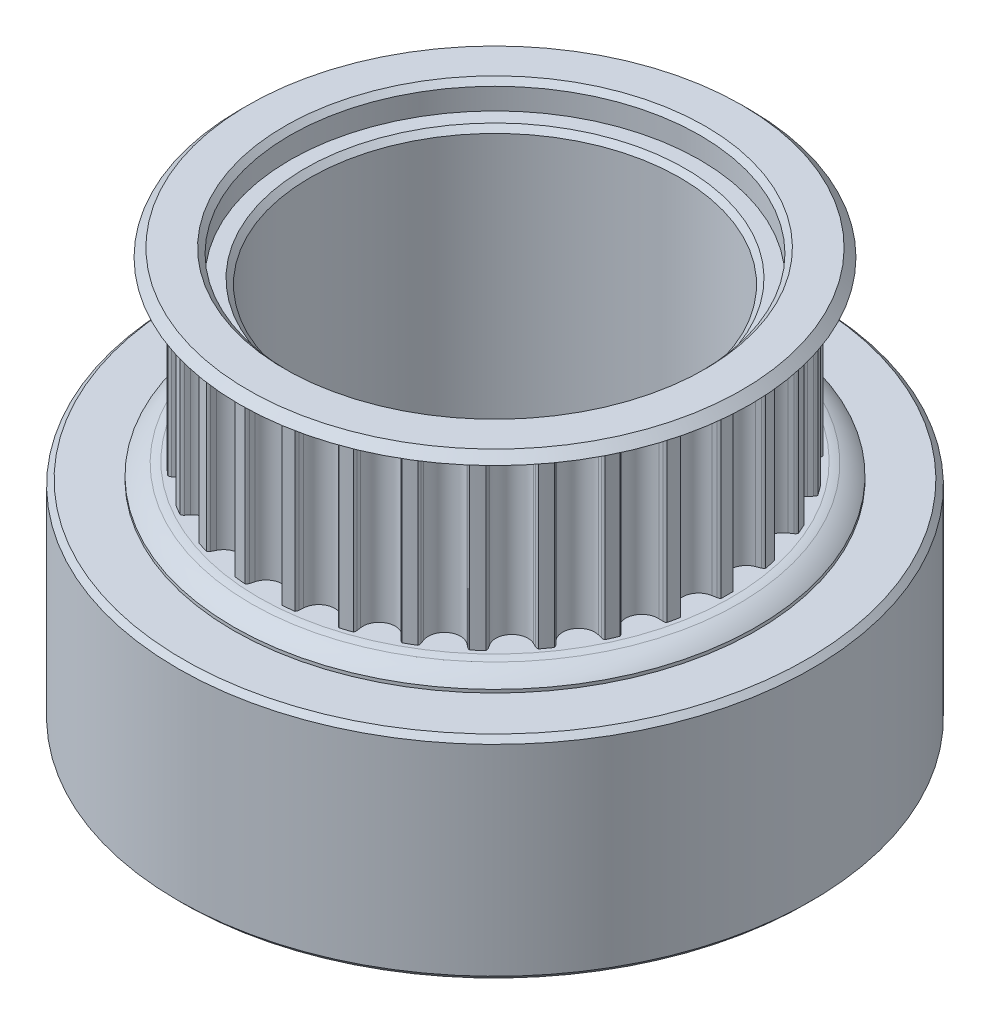
from build123d import *

# Parameters (mm, degrees)
SKETCH1_R               = 13.942945337
TOOTHOD_DEPTH           = 5.08
TOOTHPROFILE_DEPTH      = 21.362167108
TOOTHPATTERN_COUNT      = 30
LARGE_START             = 5.6325
LARGE_TOOTH_COUNT_DEPTH = 1.3675
SKETCH12_R              = 19.05
BOSS_EXTRUDE1_DEPTH     = 12.7
SKETCH13_R              = 11.1125
CUT_EXTRUDE1_DEPTH      = 37.593855085
SKETCH14_R              = 12.7
CUT_EXTRUDE2_DEPTH      = 1.6002
SKETCH15_R              = 12.319
CUT_EXTRUDE3_DEPTH      = 1.6002
CHAMFER1_SIZE           = 0.3175
CHAMFER2_SIZE           = 0.3175
CHAMFER3_SIZE           = 0.889


with BuildPart() as part:
    # Sketch1 → ToothOD (new, symmetric)
    with BuildSketch(Plane(origin=(0, 0, 0), x_dir=(1, 0, 0), z_dir=(0, 1, 0))):
        with Locations(Location((0, 0, 0), (0, 0, 270))):
            Circle(SKETCH1_R)
    extrude(amount=TOOTHOD_DEPTH, both=True)

    # Sketch2 → ToothProfile (cut, symmetric)
    with BuildSketch(Plane(origin=(0, 0, 0), x_dir=(1, 0, 0), z_dir=(0, 1, 0))):
        with BuildLine():
            ThreePointArc((-0.937033068, 13.493007333), (-0.590385173, 12.974832723), (0, 12.774545337))
            ThreePointArc((0, 12.774545337), (0.590385173, 12.974832723), (0.937033068, 13.493007333))
            ThreePointArc((0.937033068, 13.493007333), (0.971699064, 13.619118795), (1.007805813, 13.744825337))
            ThreePointArc((1.007805813, 13.744825337), (1.04827578, 13.830028138), (1.113221937, 13.898433782))
            ThreePointArc((1.113221937, 13.898433782), (0, 13.942945337), (-1.113221937, 13.898433782))
            ThreePointArc((-1.113221937, 13.898433782), (-1.04827578, 13.830028138), (-1.007805813, 13.744825337))
            ThreePointArc((-1.007805813, 13.744825337), (-0.971699064, 13.619118795), (-0.937033068, 13.493007333))
        make_face()
    toothprofile = extrude(amount=TOOTHPROFILE_DEPTH, both=True, mode=Mode.SUBTRACT)

    # ToothPattern: ToothProfile ×30 about axis
    toothpattern_axis = Axis((0, 0, 0), (0, 1, 0))
    for i in range(1, TOOTHPATTERN_COUNT):
        add(toothprofile.rotate(toothpattern_axis, i * 360 / TOOTHPATTERN_COUNT), mode=Mode.SUBTRACT)

    # Sketch4 → Flange (revolve)
    with BuildSketch(Plane.XY, mode=Mode.PRIVATE) as flange_sk:
        with BuildLine():
            Line((0, -5.08), (14.196945337, -5.08))
            ThreePointArc((14.196945337, -5.08), (14.426591958, -5.115951298), (14.652017665, -5.172637424))
            ThreePointArc((14.652017665, -5.172637424), (15.219746242, -5.454197125), (15.720945337, -5.842))
            Line((15.720945337, -5.842), (15.720945337, -6.0325))
            Line((15.720945337, -6.0325), (0, -6.0325))
            Line((0, -6.0325), (0, -5.08))
        make_face()
        with BuildLine():
            Line((15.720945337, 6.0325), (15.720945337, 5.842))
            ThreePointArc((15.720945337, 5.842), (15.219746242, 5.454197125), (14.652017665, 5.172637424))
            ThreePointArc((14.652017665, 5.172637424), (14.426591958, 5.115951298), (14.196945337, 5.08))
            Line((14.196945337, 5.08), (0, 5.08))
            Line((0, 5.08), (0, 6.0325))
            Line((0, 6.0325), (15.720945337, 6.0325))
        make_face()
    revolve(flange_sk.sketch.rotate(Axis((0, 8.73125, 0), (0, -1, 0)), 90), axis=Axis((0, 8.73125, 0), (0, -1, 0)))

    # Large Tooth Count: read off the stored shape, not the designer's step
    # Large Tooth Count outline → Large Tooth Count (cut)
    # profile 1 of 2: a face of its own
    with BuildSketch(Plane(origin=(0, 0, 0), x_dir=(1, 0, 0), z_dir=(0, 1, 0)).offset(LARGE_START)):
        with BuildLine():
            add(Edge.make_bspline(
                [(3.894236719, 10.338692969), (3.901916731, 10.292057015), (3.917793763, 10.195645638), (3.925855583, 10.04382702), (3.927405181, 9.88165912), (3.91663913, 9.708484938), (3.897025732, 9.524940839), (3.866969089, 9.330490815), (3.827897551, 9.125211805), (3.79505084, 8.985432902), (3.778150781, 8.913514844)],
                knots=[0, 0, 0, 0, 0.098412255, 0.20344949, 0.316329363, 0.436224099, 0.564713832, 0.700846686, 0.84608174, 1, 1, 1, 1], degree=3))
            add(Edge.make_bspline(
                [(2.820888281, 11.507589062), (2.869414473, 11.494553642), (2.964310988, 11.469061924), (3.099186919, 11.41527872), (3.224642668, 11.352445393), (3.339573531, 11.277689048), (3.444280904, 11.193341702), (3.540153241, 11.100296317), (3.623844048, 10.995849089), (3.698334598, 10.882866857), (3.762985924, 10.760583873), (3.817301104, 10.628654462), (3.862284944, 10.487369798), (3.883445455, 10.388906483), (3.894236719, 10.338692969)],
                knots=[0, 0, 0, 0, 0.089277524, 0.174588721, 0.257670783, 0.338413673, 0.417848417, 0.496444716, 0.575467554, 0.655324359, 0.736770208, 0.821005813, 0.908718012, 1, 1, 1, 1], degree=3))
            add(Edge.make_bspline(
                [(1.336774219, 10.975379688), (1.359545364, 11.005507681), (1.40431059, 11.064735553), (1.478186261, 11.146141205), (1.554984069, 11.22026595), (1.634663261, 11.28777983), (1.717999776, 11.347711489), (1.804600367, 11.400810688), (1.895150095, 11.445205889), (1.988481682, 11.483047165), (2.084591569, 11.513417291), (2.18323999, 11.535505994), (2.284037248, 11.551121753), (2.387093352, 11.558084685), (2.492720013, 11.55684089), (2.600440249, 11.54896046), (2.71061723, 11.533037624), (2.783785753, 11.516151654), (2.820888281, 11.507589062)],
                knots=[0, 0, 0, 0, 0.067302816, 0.13230893, 0.195736244, 0.257501144, 0.318328765, 0.378579543, 0.438386976, 0.49790884, 0.557995798, 0.61785971, 0.677977126, 0.739682721, 0.801775047, 0.866165223, 0.932134633, 1, 1, 1, 1], degree=3))
            add(Edge.make_bspline(
                [(0.793849219, 9.592171094), (0.812119434, 9.665225645), (0.847760684, 9.807739326), (0.907837688, 10.013678281), (0.970226185, 10.207405296), (1.035985365, 10.388347446), (1.104857482, 10.556220165), (1.178846885, 10.709215908), (1.25326624, 10.849310477), (1.309629122, 10.93439964), (1.336774219, 10.975379688)],
                knots=[0, 0, 0, 0, 0.151252288, 0.295060605, 0.430820637, 0.560008289, 0.68170513, 0.795094504, 0.901314847, 1, 1, 1, 1], degree=3))
            add(Edge.make_bspline(
                [(0.674191406, 8.356302344), (0.670127884, 8.401811485), (0.661853082, 8.494484562), (0.658554359, 8.636721724), (0.663427053, 8.783911552), (0.674765904, 8.936236694), (0.695212076, 9.093362462), (0.720728065, 9.255785235), (0.753987411, 9.422788104), (0.780417574, 9.535096609), (0.793849219, 9.592171094)],
                knots=[0, 0, 0, 0, 0.109828413, 0.223650385, 0.341784368, 0.463797518, 0.590729468, 0.722618112, 0.859036246, 1, 1, 1, 1], degree=3))
            add(Edge.make_bspline(
                [(1.762720312, 7.100788281), (1.726485301, 7.110219213), (1.654854194, 7.128862731), (1.551943937, 7.168683435), (1.452777386, 7.212229662), (1.359157063, 7.265071877), (1.270121863, 7.323686891), (1.185224217, 7.389237766), (1.106228149, 7.462850417), (1.030952794, 7.541915561), (0.962512555, 7.627529404), (0.900791846, 7.71819116), (0.845202939, 7.812869749), (0.796603975, 7.912499165), (0.756128877, 8.017031257), (0.720740624, 8.125645527), (0.692960862, 8.239083587), (0.680499048, 8.31690994), (0.674191406, 8.356302344)],
                knots=[0, 0, 0, 0, 0.06345532, 0.125441517, 0.186905328, 0.247025311, 0.307517243, 0.367605419, 0.428703197, 0.490489634, 0.552621639, 0.614377127, 0.676375659, 0.738696092, 0.802167478, 0.8663517, 0.93235289, 1, 1, 1, 1], degree=3))
            add(Edge.make_bspline(
                [(3.141464062, 7.504410156), (3.094364004, 7.45904324), (3.001525209, 7.369620639), (2.844701739, 7.259870554), (2.678862343, 7.1720256), (2.504423623, 7.107731829), (2.323358035, 7.066649143), (2.137984937, 7.053700322), (1.949409538, 7.060734477), (1.82556407, 7.087305277), (1.762720312, 7.100788281)],
                knots=[0, 0, 0, 0, 0.130088367, 0.256416819, 0.379732325, 0.502967998, 0.625660579, 0.74815677, 0.872205458, 1, 1, 1, 1], degree=3))
            add(Edge.make_bspline(
                [(3.778150781, 8.913514844), (3.758210931, 8.835069277), (3.719734134, 8.683697325), (3.654537704, 8.467784966), (3.586432321, 8.270667435), (3.516707047, 8.090226333), (3.437981516, 7.925407307), (3.350580376, 7.773033966), (3.252607818, 7.631896464), (3.178276301, 7.546635257), (3.141464062, 7.504410156)],
                knots=[0, 0, 0, 0, 0.155353781, 0.299777364, 0.432766126, 0.555630248, 0.670888315, 0.78300349, 0.892533779, 1, 1, 1, 1], degree=3))
        make_face()
        with BuildLine():
            add(Edge.make_bspline(
                [(1.895772656, 7.674074219), (1.917431552, 7.669511455), (1.95987923, 7.66056923), (2.023623586, 7.654108351), (2.085281196, 7.655205787), (2.144713003, 7.661949258), (2.201703762, 7.676544585), (2.256580265, 7.698164562), (2.309218275, 7.726865048), (2.37780689, 7.775030825), (2.459600173, 7.851841236), (2.548068709, 7.965693825), (2.63173208, 8.101218004), (2.693557362, 8.230444536), (2.740743866, 8.346145341), (2.778592813, 8.441570755), (2.813706711, 8.545425584), (2.850844837, 8.655509634), (2.885893356, 8.774089935), (2.923102942, 8.898995595), (2.957340831, 9.032174447), (2.980453294, 9.123060876), (2.992338281, 9.169796875)],
                knots=[0, 0, 0, 0, 0.0322864, 0.063275743, 0.093249982, 0.122127816, 0.150361453, 0.178834645, 0.207988828, 0.237630766, 0.300949605, 0.370821424, 0.447482609, 0.532959593, 0.579503437, 0.62983717, 0.682724401, 0.739453358, 0.799364059, 0.863146039, 0.929626385, 1, 1, 1, 1], degree=3))
            add(Edge.make_bspline(
                [(1.6144875, 9.482335938), (1.603726759, 9.436806536), (1.582651627, 9.347636275), (1.552496469, 9.21662273), (1.528467436, 9.090977592), (1.504918347, 8.971625086), (1.488028832, 8.857932651), (1.47216347, 8.75030125), (1.460659497, 8.648445202), (1.449800154, 8.523534382), (1.446772112, 8.379655916), (1.456939252, 8.220807756), (1.484788768, 8.080533086), (1.522740626, 7.976807846), (1.561161367, 7.90415918), (1.595831471, 7.857045773), (1.633087022, 7.813257774), (1.676719701, 7.775542692), (1.724977584, 7.74290427), (1.777203971, 7.713644995), (1.834552387, 7.690434036), (1.875101134, 7.679598244), (1.895772656, 7.674074219)],
                knots=[0, 0, 0, 0, 0.069238648, 0.135605306, 0.198930111, 0.258544042, 0.315613518, 0.369002577, 0.419546225, 0.467286253, 0.554525106, 0.632266141, 0.702416642, 0.765420408, 0.794987156, 0.823715053, 0.851811191, 0.879907329, 0.9087431, 0.93792338, 0.96835369, 1, 1, 1, 1], degree=3))
            add(Edge.make_bspline(
                [(2.690514844, 10.933410156), (2.659689633, 10.939648364), (2.599645863, 10.951799635), (2.509369027, 10.954924508), (2.423423844, 10.94197368), (2.341498764, 10.915795422), (2.263932177, 10.874944749), (2.19098721, 10.819478314), (2.122764926, 10.749778166), (2.059450384, 10.66540212), (1.998899965, 10.567339232), (1.940015427, 10.454938773), (1.882663247, 10.328243869), (1.82511002, 10.187589391), (1.770014548, 10.031950273), (1.717162785, 9.861584316), (1.664015436, 9.67710305), (1.631391416, 9.548810075), (1.6144875, 9.482335938)],
                knots=[0, 0, 0, 0, 0.047014119, 0.0915778, 0.134351293, 0.176470361, 0.219705237, 0.264872576, 0.313064184, 0.365182147, 0.422408158, 0.485372449, 0.554936154, 0.630457004, 0.712736234, 0.80191367, 0.897362907, 1, 1, 1, 1], degree=3))
            add(Edge.make_bspline(
                [(2.992338281, 9.169796875), (3.00331221, 9.214087916), (3.024761386, 9.300657306), (3.051879167, 9.428634175), (3.077066724, 9.550578826), (3.099028303, 9.666859416), (3.115358856, 9.777512558), (3.130187763, 9.882196019), (3.140857019, 9.981368546), (3.150431123, 10.103046348), (3.152968095, 10.243327603), (3.142068531, 10.398156052), (3.112807563, 10.534385708), (3.074945104, 10.635418058), (3.034198784, 10.705076117), (3.000726783, 10.752812258), (2.961095102, 10.794888272), (2.916408449, 10.831850632), (2.867480663, 10.865296163), (2.812500109, 10.892504077), (2.753414148, 10.916093304), (2.711778417, 10.927556067), (2.690514844, 10.933410156)],
                knots=[0, 0, 0, 0, 0.068708903, 0.134295506, 0.196973272, 0.256228657, 0.312458617, 0.365390344, 0.415434452, 0.462635647, 0.54915566, 0.626507233, 0.69578835, 0.758382716, 0.787905111, 0.817136839, 0.845995028, 0.874633069, 0.904345408, 0.935016025, 0.966812364, 1, 1, 1, 1], degree=3))
        make_face(mode=Mode.SUBTRACT)
    # profile 2 of 2: a face of its own
    with BuildSketch(Plane(origin=(0, 0, 0), x_dir=(1, 0, 0), z_dir=(0, 1, 0)).offset(LARGE_START)):
        with BuildLine():
            add(Edge.make_bspline(
                [(-2.94594696, 9.277684109), (-2.949917568, 9.29962064), (-2.957676953, 9.342489144), (-2.952309575, 9.407415503), (-2.930459491, 9.468217654), (-2.895156071, 9.52532543), (-2.843820429, 9.577128015), (-2.77633668, 9.620205468), (-2.69460196, 9.65743178), (-2.633718848, 9.674169015), (-2.601261023, 9.683091921)],
                knots=[0, 0, 0, 0, 0.111385208, 0.217669656, 0.321925023, 0.432447933, 0.551639791, 0.684027163, 0.831549495, 1, 1, 1, 1], degree=3))
            add(Edge.make_bspline(
                [(-2.537860241, 9.067836452), (-2.563345482, 9.062582269), (-2.611900796, 9.052571826), (-2.683195784, 9.05054596), (-2.748054181, 9.060179778), (-2.806177123, 9.08120024), (-2.855660967, 9.115528836), (-2.896469735, 9.159890359), (-2.927478145, 9.215059165), (-2.939622395, 9.256238469), (-2.94594696, 9.277684109)],
                knots=[0, 0, 0, 0, 0.149888658, 0.285572774, 0.408932043, 0.52629045, 0.638683176, 0.752910103, 0.87131883, 1, 1, 1, 1], degree=3))
            add(Edge.make_bspline(
                [(-2.20299696, 9.174099734), (-2.214034855, 9.171208214), (-2.238920184, 9.16468918), (-2.279758872, 9.151666389), (-2.329005407, 9.137210905), (-2.381806266, 9.117898242), (-2.433232347, 9.100124068), (-2.477418199, 9.085951626), (-2.510858631, 9.074847802), (-2.530101116, 9.069851219), (-2.537860241, 9.067836452)],
                knots=[0, 0, 0, 0, 0.097390688, 0.219570781, 0.365850052, 0.535413751, 0.699343424, 0.830322618, 0.931581186, 1, 1, 1, 1], degree=3))
            add(Edge.make_bspline(
                [(-1.315386023, 8.61956614), (-1.322709249, 8.647075291), (-1.336962987, 8.700618386), (-1.364840565, 8.777179887), (-1.397782915, 8.847667999), (-1.435347332, 8.912294619), (-1.477381013, 8.971014306), (-1.524950804, 9.022948856), (-1.577295531, 9.068691377), (-1.633172867, 9.109131522), (-1.693697714, 9.142031721), (-1.75706734, 9.16956536), (-1.824593544, 9.187521739), (-1.894389567, 9.200753768), (-1.96753284, 9.204698034), (-2.0434192, 9.201926041), (-2.122628351, 9.192092813), (-2.175698243, 9.180211423), (-2.20299696, 9.174099734)],
                knots=[0, 0, 0, 0, 0.071899262, 0.13994285, 0.205548865, 0.268236407, 0.328560647, 0.387648672, 0.445732678, 0.503957705, 0.561518399, 0.619485437, 0.67805912, 0.737657048, 0.798689693, 0.862654426, 0.929350565, 1, 1, 1, 1], degree=3))
            add(Edge.make_bspline(
                [(-1.86724071, 7.681055984), (-1.837183626, 7.689463317), (-1.777450291, 7.706171459), (-1.692639817, 7.745990775), (-1.611999849, 7.794891645), (-1.536938547, 7.854887079), (-1.469078658, 7.924668545), (-1.409270706, 8.003195208), (-1.362344355, 8.092435819), (-1.323643469, 8.188158463), (-1.297548488, 8.290794376), (-1.286782816, 8.397884164), (-1.292192894, 8.508640463), (-1.307514329, 8.581918224), (-1.315386023, 8.61956614)],
                knots=[0, 0, 0, 0, 0.077153613, 0.153329661, 0.231058322, 0.310240628, 0.390495891, 0.471559113, 0.553664103, 0.639329823, 0.726730839, 0.814871257, 0.904886403, 1, 1, 1, 1], degree=3))
            add(Edge.make_bspline(
                [(-2.880760241, 8.279345046), (-2.840146087, 8.221924331), (-2.763275821, 8.113244348), (-2.643134651, 7.968332618), (-2.526935312, 7.849477456), (-2.42922311, 7.769989931), (-2.350209293, 7.720824629), (-2.289399441, 7.69360621), (-2.226163443, 7.672124327), (-2.159648697, 7.66052623), (-2.090325201, 7.653466747), (-2.018261324, 7.656288181), (-1.943083379, 7.663601664), (-1.893040053, 7.675118561), (-1.86724071, 7.681055984)],
                knots=[0, 0, 0, 0, 0.165973302, 0.314137076, 0.443807833, 0.55781674, 0.610474885, 0.662982821, 0.714752237, 0.767667561, 0.821991507, 0.878920135, 0.937578471, 1, 1, 1, 1], degree=3))
            add(Edge.make_bspline(
                [(-3.178118835, 8.375785671), (-3.150131631, 8.380276222), (-3.093139962, 8.389420545), (-3.02162568, 8.372587399), (-2.968257695, 8.352256092), (-2.932572939, 8.33268363), (-2.90331007, 8.308201079), (-2.888190598, 8.28885335), (-2.880760241, 8.279345046)],
                knots=[0, 0, 0, 0, 0.256050239, 0.521407237, 0.655347367, 0.776762548, 0.890291534, 1, 1, 1, 1], degree=3))
            add(Edge.make_bspline(
                [(-3.470119616, 7.906977077), (-3.475325537, 7.933941849), (-3.485453596, 7.986401498), (-3.483017547, 8.065108638), (-3.463328964, 8.138895905), (-3.429411449, 8.206764734), (-3.382066956, 8.266431933), (-3.323671915, 8.315932553), (-3.254630664, 8.352875077), (-3.204042084, 8.36802325), (-3.178118835, 8.375785671)],
                knots=[0, 0, 0, 0, 0.132842496, 0.258443535, 0.377780704, 0.500379028, 0.623637807, 0.744457267, 0.869051518, 1, 1, 1, 1], degree=3))
            add(Edge.make_bspline(
                [(-1.732402429, 7.108663015), (-1.78995484, 7.096263324), (-1.902518405, 7.072011456), (-2.071623422, 7.054688982), (-2.235392196, 7.056615676), (-2.392853151, 7.075139492), (-2.541602784, 7.109784448), (-2.68132906, 7.153982565), (-2.810841487, 7.209177956), (-2.928510914, 7.276155947), (-3.03673664, 7.348561885), (-3.132731485, 7.428427523), (-3.221744177, 7.508646213), (-3.296149122, 7.594969803), (-3.359179661, 7.679673972), (-3.409306166, 7.759988139), (-3.447823434, 7.834246326), (-3.463016839, 7.883807625), (-3.470119616, 7.906977077)],
                knots=[0, 0, 0, 0, 0.08457062, 0.165406981, 0.243699319, 0.319526444, 0.39279548, 0.462876615, 0.529947367, 0.594685472, 0.657216229, 0.716814358, 0.774026302, 0.829201079, 0.880281717, 0.925628669, 0.965232085, 1, 1, 1, 1], degree=3))
            add(Edge.make_bspline(
                [(-0.522429773, 8.845487234), (-0.512804258, 8.801599057), (-0.493632908, 8.714186003), (-0.482590316, 8.579872073), (-0.485507232, 8.444693761), (-0.501330756, 8.309094168), (-0.531599076, 8.174885678), (-0.577118563, 8.043894493), (-0.634636142, 7.915435297), (-0.708793658, 7.792723738), (-0.793962139, 7.674284997), (-0.89354113, 7.564580433), (-1.005472213, 7.463185896), (-1.128143398, 7.369115663), (-1.263551577, 7.28663598), (-1.409018525, 7.213188851), (-1.566404357, 7.153656714), (-1.676464381, 7.123824996), (-1.732402429, 7.108663015)],
                knots=[0, 0, 0, 0, 0.057089976, 0.113707371, 0.170878863, 0.228819664, 0.287041721, 0.345460342, 0.404921953, 0.465687476, 0.527472611, 0.590190014, 0.653696417, 0.719337597, 0.78646923, 0.855031772, 0.926319844, 1, 1, 1, 1], degree=3))
            add(Edge.make_bspline(
                [(-1.47433446, 9.708095046), (-1.432456629, 9.696848934), (-1.350451172, 9.674826721), (-1.233436671, 9.631309675), (-1.123743746, 9.582665972), (-1.022634717, 9.525742287), (-0.928658547, 9.464090834), (-0.844220178, 9.394403389), (-0.767571743, 9.319414415), (-0.700437762, 9.236866525), (-0.642561638, 9.14789902), (-0.591621008, 9.053759217), (-0.55138575, 8.952305824), (-0.532169275, 8.881416256), (-0.522429773, 8.845487234)],
                knots=[0, 0, 0, 0, 0.095898995, 0.18779007, 0.275931845, 0.361143286, 0.444259518, 0.524291367, 0.603000555, 0.681178853, 0.759182165, 0.837559969, 0.917670375, 1, 1, 1, 1], degree=3))
            add(Edge.make_bspline(
                [(-1.211801648, 10.758226296), (-1.201267759, 10.709607183), (-1.180867972, 10.615452066), (-1.172552485, 10.47486065), (-1.180191247, 10.340898736), (-1.210288776, 10.212925101), (-1.256770723, 10.088195907), (-1.314823754, 9.961961751), (-1.387413216, 9.833798483), (-1.444790204, 9.750821247), (-1.47433446, 9.708095046)],
                knots=[0, 0, 0, 0, 0.132781047, 0.257141981, 0.375152233, 0.4901777, 0.606947917, 0.73046627, 0.861213113, 1, 1, 1, 1], degree=3))
            add(Edge.make_bspline(
                [(-2.748600866, 11.525286452), (-2.702025467, 11.535972239), (-2.610978804, 11.556861061), (-2.474273552, 11.573048977), (-2.341739477, 11.58006072), (-2.212945958, 11.574472598), (-2.08860274, 11.558631596), (-1.969505268, 11.531997259), (-1.856149597, 11.494219491), (-1.7489939, 11.446120877), (-1.649202881, 11.388120519), (-1.557302506, 11.321812308), (-1.474505332, 11.246644501), (-1.402395917, 11.161960075), (-1.338556767, 11.071121681), (-1.285688991, 10.972671336), (-1.242481103, 10.868218843), (-1.222080982, 10.795079953), (-1.211801648, 10.758226296)],
                knots=[0, 0, 0, 0, 0.074476323, 0.145588031, 0.214370502, 0.28127726, 0.34634367, 0.409637131, 0.471293809, 0.532381628, 0.592496844, 0.650996873, 0.708830001, 0.766433503, 0.824126724, 0.881664718, 0.940372517, 1, 1, 1, 1], degree=3))
            add(Edge.make_bspline(
                [(-3.891600866, 10.168866921), (-3.897202831, 10.195846888), (-3.90868872, 10.251164784), (-3.910073498, 10.338456818), (-3.901837272, 10.430290141), (-3.883046631, 10.526449345), (-3.852757408, 10.625298755), (-3.80999423, 10.724779166), (-3.757156707, 10.824812936), (-3.693816316, 10.925156711), (-3.618322569, 11.023305987), (-3.528899678, 11.116341265), (-3.427979599, 11.204953579), (-3.31409479, 11.287179692), (-3.188287123, 11.361826796), (-3.051847677, 11.428212092), (-2.904083276, 11.482688717), (-2.801219271, 11.510870514), (-2.748600866, 11.525286452)],
                knots=[0, 0, 0, 0, 0.042390355, 0.086914312, 0.133892756, 0.184370137, 0.237631347, 0.292934159, 0.351012397, 0.411851892, 0.475630372, 0.541506361, 0.610431904, 0.682380142, 0.757679111, 0.835653252, 0.915931101, 1, 1, 1, 1], degree=3))
            add(Edge.make_bspline(
                [(-3.489764929, 9.88400989), (-3.509350026, 9.8803485), (-3.548420652, 9.873044335), (-3.609434048, 9.879830829), (-3.670487729, 9.897939271), (-3.730912508, 9.928307987), (-3.787445363, 9.97036313), (-3.833267678, 10.026602881), (-3.87025299, 10.09294436), (-3.884290856, 10.142869266), (-3.891600866, 10.168866921)],
                knots=[0, 0, 0, 0, 0.108807997, 0.217062823, 0.332844788, 0.457032898, 0.586408905, 0.716289224, 0.852261817, 1, 1, 1, 1], degree=3))
            add(Edge.make_bspline(
                [(-3.237947741, 10.071533327), (-3.241150921, 10.061262772), (-3.247737035, 10.040145301), (-3.265244484, 10.010279767), (-3.289936367, 9.982330094), (-3.33300381, 9.94755018), (-3.399032396, 9.909737208), (-3.458612526, 9.892843191), (-3.489764929, 9.88400989)],
                knots=[0, 0, 0, 0, 0.097938708, 0.201373513, 0.313040821, 0.436506957, 0.705368849, 1, 1, 1, 1], degree=3))
            add(Edge.make_bspline(
                [(-2.690557898, 10.933248171), (-2.719016756, 10.92579777), (-2.773481501, 10.911539146), (-2.848797989, 10.881824573), (-2.914677693, 10.847806297), (-2.971898168, 10.80964039), (-3.018744994, 10.765584974), (-3.061466782, 10.721437135), (-3.09368593, 10.671570183), (-3.121544331, 10.619815589), (-3.142695387, 10.563051791), (-3.161211949, 10.501189113), (-3.178399596, 10.433339132), (-3.196331438, 10.336107832), (-3.21499903, 10.214702613), (-3.230458199, 10.118258063), (-3.237947741, 10.071533327)],
                knots=[0, 0, 0, 0, 0.079177472, 0.151530349, 0.2175086, 0.278658692, 0.335984232, 0.390452449, 0.443594741, 0.495234235, 0.548533521, 0.60635583, 0.669159977, 0.736925903, 0.872547826, 1, 1, 1, 1], degree=3))
            add(Edge.make_bspline(
                [(-1.977075866, 10.506409109), (-1.988169903, 10.543575506), (-2.009851232, 10.616210649), (-2.06613002, 10.714868055), (-2.139893263, 10.799858481), (-2.228850181, 10.871437819), (-2.331469935, 10.924697938), (-2.444943437, 10.953902222), (-2.56682946, 10.957080034), (-2.648180362, 10.941410689), (-2.690557898, 10.933248171)],
                knots=[0, 0, 0, 0, 0.12482849, 0.243955181, 0.363128321, 0.486121847, 0.61025751, 0.733251035, 0.861044397, 1, 1, 1, 1], degree=3))
            add(Edge.make_bspline(
                [(-2.480710241, 9.71255989), (-2.437549836, 9.724991296), (-2.353083236, 9.749320042), (-2.238504531, 9.81166263), (-2.138057351, 9.8908886), (-2.067203102, 9.970835556), (-2.020737473, 10.042859552), (-1.992926261, 10.100852847), (-1.971226077, 10.161164486), (-1.957863074, 10.224862832), (-1.951696473, 10.291361104), (-1.952782889, 10.360771697), (-1.960840318, 10.433160713), (-1.97155234, 10.481489136), (-1.977075866, 10.506409109)],
                knots=[0, 0, 0, 0, 0.127087457, 0.248715116, 0.36712366, 0.488563631, 0.549691662, 0.609731344, 0.670613998, 0.731055999, 0.793812403, 0.859672474, 0.927641792, 1, 1, 1, 1], degree=3))
            Line((-2.480710241, 9.71255989), (-2.601261023, 9.683091921))
        make_face()
    extrude(amount=LARGE_TOOTH_COUNT_DEPTH, mode=Mode.SUBTRACT)

    # Sketch12 → Boss-Extrude1 (add)
    with BuildSketch(Plane.XZ.offset(6.0325)):
        with Locations(Location((0, 0, 0), (0, 0, 270))):
            Circle(SKETCH12_R)
    extrude(amount=BOSS_EXTRUDE1_DEPTH)


with BuildPart() as part_1:
    # Body-Move/Copy2: read off the stored shape, not the designer's step
    # Body-Move/Copy2: moved
    add(part.part.moved(Location((0, 12.3825, 0))))

    # Sketch13 → Cut-Extrude1 (cut, through all)
    with BuildSketch(Plane.XZ.offset(6.35)):
        with Locations(Location((0, 0, 0), (0, 0, 270))):
            Circle(SKETCH13_R)
    extrude(amount=-CUT_EXTRUDE1_DEPTH, mode=Mode.SUBTRACT)

    # Sketch14 → Cut-Extrude2 (cut)
    with BuildSketch(Plane.XZ.offset(6.35)):
        with Locations(Location((0, 0, 0), (0, 0, 270))):
            Circle(SKETCH14_R)
    extrude(amount=-CUT_EXTRUDE2_DEPTH, mode=Mode.SUBTRACT)

    # Sketch15 → Cut-Extrude3 (cut)
    with BuildSketch(Plane(origin=(0, 18.415, 0), x_dir=(1, 0, 0), z_dir=(0, 1, 0))):
        with Locations(Location((0, 0, 0), (0, 0, 270))):
            Circle(SKETCH15_R)
    extrude(amount=-CUT_EXTRUDE3_DEPTH, mode=Mode.SUBTRACT)

    # Chamfer1
    chamfer1_edges = [part_1.edges().sort_by_distance(p)[0] for p in [
        (0, 6.35, 19.05),
        (0, -6.35, 19.05),
    ]]
    chamfer(chamfer1_edges, length=CHAMFER1_SIZE)

    # Chamfer2
    chamfer2_edges = [part_1.edges().sort_by_distance(p)[0] for p in [
        (0, -6.35, 12.7),
        (0, -4.7498, 11.1125),
        (0, 18.415, -12.319),
        (0, 16.8148, 11.1125),
    ]]
    chamfer(chamfer2_edges, length=CHAMFER2_SIZE)

    # Chamfer3
    # the kernel refuses this chamfer: 0.889 mm, written as the material it takes off along each edge
    with BuildSketch(Plane(origin=(0, 18.415, 0), x_dir=(0, 0, 1), z_dir=(1, 0, 0))) as chamfer3_piece_1:
        Polygon((15.720945337 - CHAMFER3_SIZE, 0), (15.720945337, CHAMFER3_SIZE), (15.720945337, 0), align=None)
    revolve(axis=Axis((0, 18.415, 0), (0, -1, 0)), mode=Mode.SUBTRACT)


solid = part_1.part
